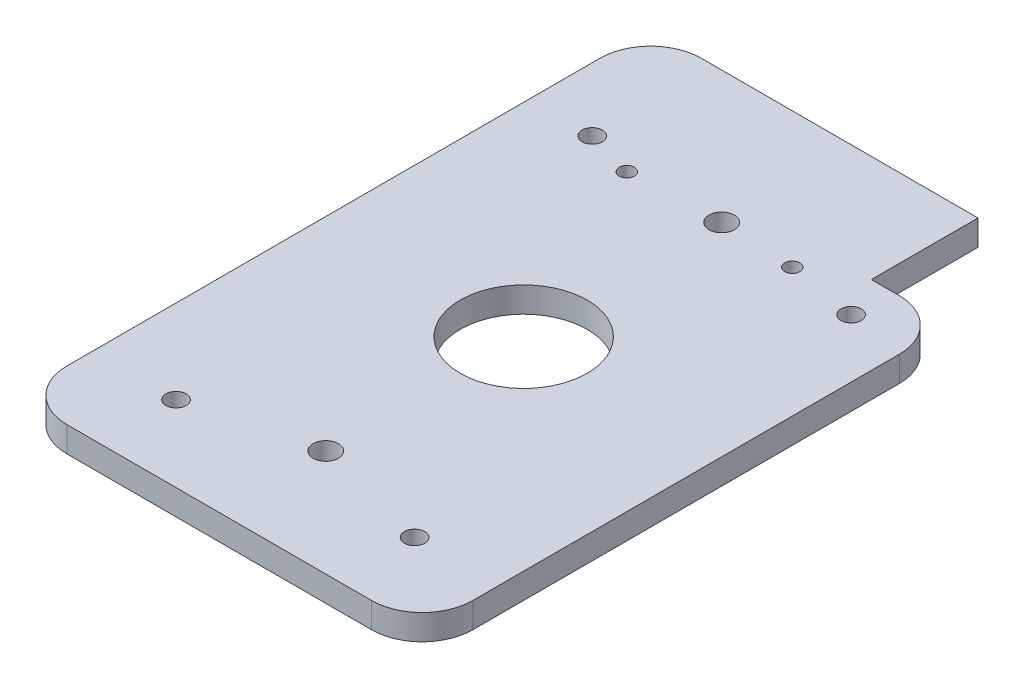
from build123d import *

# Parameters (mm, degrees)
SKETCH_1_W          = 80
SKETCH_1_H          = 125
SKETCH_1_R          = 12.5
EXTRUDE_1_DEPTH     = 5
SKETCH_2_W          = 15.5
SKETCH_2_H          = 21
CUT_EXTRUDE_1_DEPTH = 77.485292704
MM_CLEARANCE_1_D    = 4
MM_TRANSITIONAL_1_D = 5
FILLET_1_R          = 10
MM_TRANSITIONAL_2_D = 3


with BuildPart() as part:
    # 草图1 → 凸台-拉伸1 (new body)
    with BuildSketch(Plane(origin=(0, 0, 0), x_dir=(1, 0, 0), z_dir=(0, 1, 0))):
        with Locations((0, 2.5)):
            Rectangle(SKETCH_1_W, SKETCH_1_H)
        Circle(SKETCH_1_R, mode=Mode.SUBTRACT)
    extrude(amount=EXTRUDE_1_DEPTH)

    # 草图2 → 切除-拉伸1 (cut, through all)
    with BuildSketch(Plane(origin=(0, 5, 0), x_dir=(1, 0, 0), z_dir=(0, 1, 0))):
        with Locations((32.25, 54.5)):
            Rectangle(SKETCH_2_W, SKETCH_2_H)
    extrude(amount=-CUT_EXTRUDE_1_DEPTH, mode=Mode.SUBTRACT)

    # 大小mm Clearance 暗销孔1 (through all)
    with Locations(Plane(origin=(0, 5, 0), x_dir=(1, 0, 0), z_dir=(0, 1, 0))):
        with Locations((-23.5, -45), (23.5, -45), (28.5, 36), (-27.5, 41)):
            Hole(MM_CLEARANCE_1_D / 2)

    # 大小mm Transitional 暗销孔1 (through all)
    with Locations(Plane(origin=(0, 5, 0), x_dir=(1, 0, 0), z_dir=(0, 1, 0))):
        with Locations((0, -39), (0, 39)):
            Hole(MM_TRANSITIONAL_1_D / 2)

    # 圆角1
    fillet_1_edges = [part.edges().sort_by_distance(p)[0] for p in [
        (40, 2.5, 60),
        (-40, 2.5, 60),
        (-40, 2.5, -65),
        (40, 2.5, -44),
    ]]
    fillet(fillet_1_edges, radius=FILLET_1_R)

    # 大小mm Transitional 暗销孔2 (through all)
    with Locations(Plane(origin=(0, 5, 0), x_dir=(1, 0, 0), z_dir=(0, 1, 0))):
        with Locations((14.60943136, 38.3), (-18, 38.3)):
            Hole(MM_TRANSITIONAL_2_D / 2)


solid = part.part
